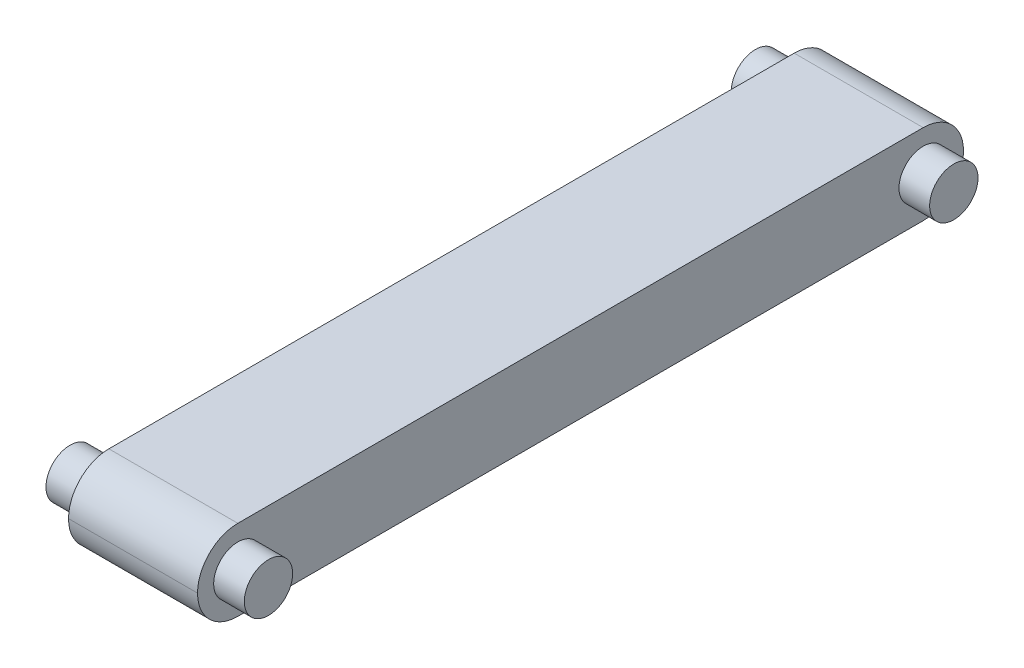
from build123d import *

# Parameters (mm, degrees)
SKETCH1_W                = 8
SKETCH1_H                = 47.5
BOSS_EXTRUDE1_DEPTH      = 5
BOSS_EXTRUDE2_DEPTH      = 1.9
BOSS_EXTRUDE2_DEPTH_BACK = 10.4
SKETCH2_R                = 1.5
FILLET1_R                = 2.5


with BuildPart() as part:
    # Sketch1 → Boss-Extrude1 (new body)
    with BuildSketch(Plane(origin=(0, 0, 0), x_dir=(1, 0, 0), z_dir=(0, 1, 0))):
        with Locations((4, 23.75)):
            Rectangle(SKETCH1_W, SKETCH1_H)
    extrude(amount=BOSS_EXTRUDE1_DEPTH)

    # Sketch2 → Boss-Extrude2 (add, two sides: drawn at the far end of the back side and taken through both)
    with BuildSketch(Plane(origin=(8, 0, 0), x_dir=(0, 0, -1), z_dir=(1, 0, 0)).offset(-BOSS_EXTRUDE2_DEPTH_BACK)):
        with Locations((2.5, 2.5)):
            Circle(SKETCH2_R)
        with Locations((45, 2.5)):
            Circle(SKETCH2_R)
    extrude(amount=BOSS_EXTRUDE2_DEPTH + BOSS_EXTRUDE2_DEPTH_BACK)

    # Fillet1
    fillet1_edges = [part.edges().sort_by_distance(p)[0] for p in [
        (4, 0, -47.5),
        (4, 5, -47.5),
        (4, 0, 0),
        (4, 5, 0),
    ]]
    fillet(fillet1_edges, radius=FILLET1_R - 0.0001)  # a hair under: the kernel refuses the full size


solid = part.part
